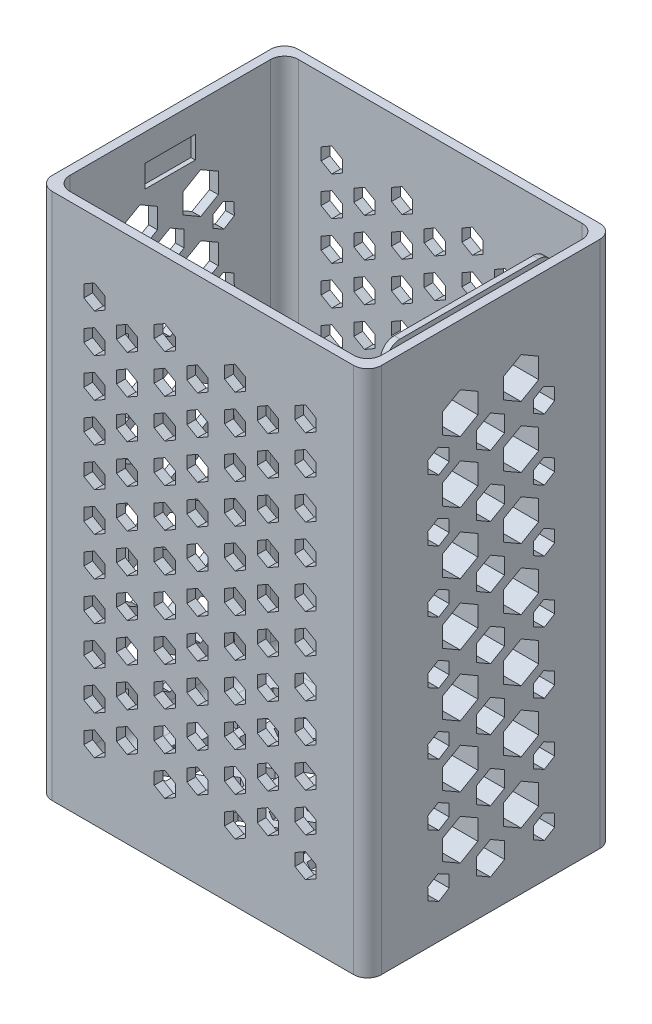
from build123d import *

# Parameters (mm, degrees)
SKETCH1_W                = 237.6932
SKETCH1_H                = 177.6984
SKETCH1_W_2              = 224.9932
SKETCH1_H_2              = 164.9984
BOSS_EXTRUDE1_DEPTH      = 374.65
SKETCH4_W                = 107.442
SKETCH4_H                = 374.65
BOSS_EXTRUDE2_DEPTH      = 9.017
SKETCH5_W                = 120.142
SKETCH5_H                = 374.65
BOSS_EXTRUDE3_DEPTH      = 4.191
SKETCH7_W                = 9.017
SKETCH7_H                = 107.442
CUT_EXTRUDE1_DEPTH       = 21.59
SKETCH10_W               = 4.191
SKETCH10_H               = 120.142
CUT_EXTRUDE2_DEPTH       = 5.588
FILLET1_R                = 10
FILLET2_R                = 10
FILLET3_R                = 10
FILLET4_R                = 10
FILLET5_R                = 10
FILLET6_R                = 10
FILLET7_R                = 10
SKETCH11_W               = 50.8
SKETCH11_H               = 15.24
BOSS_EXTRUDE4_DEPTH      = 19.9898
FILLET10_R               = 10
FILLET11_R               = 10
BOSS_EXTRUDE5_DEPTH      = 6.35
FILLET13_R               = 10
SKETCH13_W               = 36.3982
SKETCH13_H               = 16.129
CUT_EXTRUDE4_DEPTH       = 3.175
CUT_EXTRUDE5_DEPTH       = 6.35
CUT_EXTRUDE6_DEPTH       = 467.160768578
CUT_EXTRUDE6_DEPTH_BACK  = 467.160768578
CUT_EXTRUDE9_DEPTH       = 475.825252118
CUT_EXTRUDE9_DEPTH_BACK  = 475.825252118
CUT_EXTRUDE10_DEPTH      = 476.626906313
CUT_EXTRUDE10_DEPTH_BACK = 476.626906313
CUT_EXTRUDE11_DEPTH      = 476.626906313
CUT_EXTRUDE11_DEPTH_BACK = 476.626906313


with BuildPart() as part:
    # Sketch1 → Boss-Extrude1 (new body)
    with BuildSketch(Plane(origin=(0, 0, 0), x_dir=(1, 0, 0), z_dir=(0, 1, 0))):
        with Locations((112.4966, -82.4992)):
            Rectangle(SKETCH1_W, SKETCH1_H)
        with Locations((112.4966, -82.4992)):
            Rectangle(SKETCH1_W_2, SKETCH1_H_2, mode=Mode.SUBTRACT)
    extrude(amount=BOSS_EXTRUDE1_DEPTH)

    # Sketch4 → Boss-Extrude2 (add)
    with BuildSketch(Plane.ZY.offset(-224.9932)):
        with Locations((82.4484, 187.325)):
            Rectangle(SKETCH4_W, SKETCH4_H)
    extrude(amount=BOSS_EXTRUDE2_DEPTH)

    # Sketch5 → Boss-Extrude3 (add)
    with BuildSketch(Plane.ZY.offset(-215.9762)):
        with Locations((82.4484, 187.325)):
            Rectangle(SKETCH5_W, SKETCH5_H)
    extrude(amount=BOSS_EXTRUDE3_DEPTH)

    # Sketch7 → Cut-Extrude1 (cut)
    with BuildSketch(Plane(origin=(0, 374.65, 0), x_dir=(1, 0, 0), z_dir=(0, 1, 0))):
        with Locations((220.4847, -82.4484)):
            Rectangle(SKETCH7_W, SKETCH7_H)
    extrude(amount=-CUT_EXTRUDE1_DEPTH, mode=Mode.SUBTRACT)

    # Sketch10 → Cut-Extrude2 (cut)
    with BuildSketch(Plane(origin=(0, 374.65, 0), x_dir=(1, 0, 0), z_dir=(0, 1, 0))):
        with Locations((213.8807, -82.4484)):
            Rectangle(SKETCH10_W, SKETCH10_H)
    extrude(amount=-CUT_EXTRUDE2_DEPTH, mode=Mode.SUBTRACT)

    # Fillet1
    fillet1_edges = [part.edges().sort_by_distance(p)[0] for p in [
        (231.3432, 187.325, 171.3484),
    ]]
    fillet(fillet1_edges, radius=FILLET1_R)

    # Fillet2
    fillet2_edges = [part.edges().sort_by_distance(p)[0] for p in [
        (224.9932, 187.325, 164.9984),
    ]]
    fillet(fillet2_edges, radius=FILLET2_R)

    # Fillet3
    fillet3_edges = [part.edges().sort_by_distance(p)[0] for p in [
        (231.3432, 187.325, -6.35),
        (224.9932, 187.325, 0),
    ]]
    fillet(fillet3_edges, radius=FILLET3_R)

    # Fillet4
    fillet4_edges = [part.edges().sort_by_distance(p)[0] for p in [
        (-6.35, 187.325, 171.3484),
        (0, 187.325, 164.9984),
    ]]
    fillet(fillet4_edges, radius=FILLET4_R)

    # Fillet5
    fillet5_edges = [part.edges().sort_by_distance(p)[0] for p in [
        (0, 187.325, 0),
        (-6.35, 187.325, -6.35),
    ]]
    fillet(fillet5_edges, radius=FILLET5_R)

    # Fillet6
    fillet6_edges = [part.edges().sort_by_distance(p)[0] for p in [
        (220.4847, 353.06, 136.1694),
        (220.4847, 353.06, 28.7274),
    ]]
    fillet(fillet6_edges, radius=FILLET6_R)

    # Fillet7
    fillet7_edges = [part.edges().sort_by_distance(p)[0] for p in [
        (213.8807, 369.062, 22.3774),
        (213.8807, 369.062, 142.5194),
    ]]
    fillet(fillet7_edges, radius=FILLET7_R)

    # Sketch11 → Boss-Extrude4 (add)
    with BuildSketch(Plane.ZY.offset(-211.7852)):
        with Locations((82.4484, 7.62)):
            Rectangle(SKETCH11_W, SKETCH11_H)
    extrude(amount=BOSS_EXTRUDE4_DEPTH)

    # Fillet10
    fillet10_edges = [part.edges().sort_by_distance(p)[0] for p in [
        (191.7954, 7.62, 107.8484),
        (191.7954, 7.62, 57.0484),
    ]]
    fillet(fillet10_edges, radius=FILLET10_R)

    # Fillet11
    fillet11_edges = [part.edges().sort_by_distance(p)[0] for p in [
        (206.7903, 15.24, 107.8484),
        (194.724332188, 15.24, 104.919467812),
        (206.7903, 15.24, 57.0484),
        (194.724332188, 15.24, 59.977332188),
        (191.7954, 15.24, 82.4484),
    ]]
    fillet(fillet11_edges, radius=FILLET11_R)

    # Sketch12 → Boss-Extrude5 (add)
    with BuildSketch(Plane.XZ):
        with BuildLine():
            Line((231.3432, 161.3484), (231.3432, 3.65))
            ThreePointArc((231.3432, 3.65), (228.414267812, -3.421067812), (221.3432, -6.35))
            Line((221.3432, -6.35), (3.65, -6.35))
            ThreePointArc((3.65, -6.35), (-3.421067812, -3.421067812), (-6.35, 3.65))
            Line((-6.35, 3.65), (-6.35, 161.3484))
            ThreePointArc((-6.35, 161.3484), (-3.421067812, 168.419467812), (3.65, 171.3484))
            Line((3.65, 171.3484), (221.3432, 171.3484))
            ThreePointArc((221.3432, 171.3484), (228.414267812, 168.419467812), (231.3432, 161.3484))
        make_face()
    extrude(amount=BOSS_EXTRUDE5_DEPTH)

    # Fillet13
    fillet13_edges = [part.edges().sort_by_distance(p)[0] for p in [
        (224.9932, 0, 19.3637),
        (222.064267812, 0, 2.928932188),
        (112.4966, 0, 0),
        (2.928932188, 0, 2.928932188),
        (224.9932, 0, 145.5839),
        (222.064267812, 0, 162.069467812),
        (112.4966, 0, 164.9984),
        (2.928932188, 0, 162.069467812),
        (0, 0, 82.4992),
    ]]
    fillet(fillet13_edges, radius=FILLET13_R)

    # Sketch13 → Cut-Extrude4 (cut)
    with BuildSketch(Plane(origin=(0, 0, 0), x_dir=(0, 0, -1), z_dir=(1, 0, 0))):
        with Locations((-82.5551, 346.9767)):
            Rectangle(SKETCH13_W, SKETCH13_H)
    extrude(amount=-CUT_EXTRUDE4_DEPTH, mode=Mode.SUBTRACT)

    # Sketch15 → Cut-Extrude5 (cut)
    with BuildSketch(Plane.XZ.offset(6.35)):
        Polygon((177.8, 131.139877372), (184.15, 134.806051581), (184.15, 142.1384), (177.8, 145.80457421), (171.45, 142.1384), (171.45, 134.806051581), align=None)
        Polygon((196.85, 131.139877372), (203.2, 134.806051581), (203.2, 142.1384), (196.85, 145.80457421), (190.5, 142.1384), (190.5, 134.806051581), align=None)
        Polygon((158.75, 131.139877372), (165.1, 134.806051581), (165.1, 142.1384), (158.75, 145.80457421), (152.4, 142.1384), (152.4, 134.806051581), align=None)
        Polygon((139.7, 131.139877372), (146.05, 134.806051581), (146.05, 142.1384), (139.7, 145.80457421), (133.35, 142.1384), (133.35, 134.806051581), align=None)
        Polygon((120.65, 131.139877372), (127, 134.806051581), (127, 142.1384), (120.65, 145.80457421), (114.3, 142.1384), (114.3, 134.806051581), align=None)
        Polygon((101.6, 131.139877372), (107.95, 134.806051581), (107.95, 142.1384), (101.6, 145.80457421), (95.25, 142.1384), (95.25, 134.806051581), align=None)
        Polygon((82.55, 131.139877372), (88.9, 134.806051581), (88.9, 142.1384), (82.55, 145.80457421), (76.2, 142.1384), (76.2, 134.806051581), align=None)
        Polygon((63.5, 131.139877372), (69.85, 134.806051581), (69.85, 142.1384), (63.5, 145.80457421), (57.15, 142.1384), (57.15, 134.806051581), align=None)
        Polygon((44.45, 131.139877372), (50.8, 134.806051581), (50.8, 142.1384), (44.45, 145.80457421), (38.1, 142.1384), (38.1, 134.806051581), align=None)
        Polygon((25.4, 131.139877372), (31.75, 134.806051581), (31.75, 142.1384), (25.4, 145.80457421), (19.05, 142.1384), (19.05, 134.806051581), align=None)
        Polygon((32.471566581, 113.225602985), (38.821566581, 116.891777194), (38.821566581, 124.224125613), (32.471566581, 127.890299822), (26.121566581, 124.224125613), (26.121566581, 116.891777194), align=None)
        Polygon((51.521566581, 113.225602985), (57.871566581, 116.891777194), (57.871566581, 124.224125613), (51.521566581, 127.890299822), (45.171566581, 124.224125613), (45.171566581, 116.891777194), align=None)
        Polygon((70.571566581, 113.225602985), (76.921566581, 116.891777194), (76.921566581, 124.224125613), (70.571566581, 127.890299822), (64.221566581, 124.224125613), (64.221566581, 116.891777194), align=None)
        Polygon((89.621566581, 113.225602985), (95.971566581, 116.891777194), (95.971566581, 124.224125613), (89.621566581, 127.890299822), (83.271566581, 124.224125613), (83.271566581, 116.891777194), align=None)
        Polygon((108.671566581, 113.225602985), (115.021566581, 116.891777194), (115.021566581, 124.224125613), (108.671566581, 127.890299822), (102.321566581, 124.224125613), (102.321566581, 116.891777194), align=None)
        Polygon((127.721566581, 113.225602985), (134.071566581, 116.891777194), (134.071566581, 124.224125613), (127.721566581, 127.890299822), (121.371566581, 124.224125613), (121.371566581, 116.891777194), align=None)
        Polygon((146.771566581, 113.225602985), (153.121566581, 116.891777194), (153.121566581, 124.224125613), (146.771566581, 127.890299822), (140.421566581, 124.224125613), (140.421566581, 116.891777194), align=None)
        Polygon((165.821566581, 113.225602985), (172.171566581, 116.891777194), (172.171566581, 124.224125613), (165.821566581, 127.890299822), (159.471566581, 124.224125613), (159.471566581, 116.891777194), align=None)
        Polygon((184.871566581, 113.225602985), (191.221566581, 116.891777194), (191.221566581, 124.224125613), (184.871566581, 127.890299822), (178.521566581, 124.224125613), (178.521566581, 116.891777194), align=None)
        Polygon((25.4, 95.311328598), (31.75, 98.977502807), (31.75, 106.309851226), (25.4, 109.976025435), (19.05, 106.309851226), (19.05, 98.977502807), align=None)
        Polygon((44.45, 95.311328598), (50.8, 98.977502807), (50.8, 106.309851226), (44.45, 109.976025435), (38.1, 106.309851226), (38.1, 98.977502807), align=None)
        Polygon((63.5, 95.311328598), (69.85, 98.977502807), (69.85, 106.309851226), (63.5, 109.976025435), (57.15, 106.309851226), (57.15, 98.977502807), align=None)
        Polygon((82.55, 95.311328598), (88.9, 98.977502807), (88.9, 106.309851226), (82.55, 109.976025435), (76.2, 106.309851226), (76.2, 98.977502807), align=None)
        Polygon((101.6, 95.311328598), (107.95, 98.977502807), (107.95, 106.309851226), (101.6, 109.976025435), (95.25, 106.309851226), (95.25, 98.977502807), align=None)
        Polygon((120.65, 95.311328598), (127, 98.977502807), (127, 106.309851226), (120.65, 109.976025435), (114.3, 106.309851226), (114.3, 98.977502807), align=None)
        Polygon((139.7, 95.311328598), (146.05, 98.977502807), (146.05, 106.309851226), (139.7, 109.976025435), (133.35, 106.309851226), (133.35, 98.977502807), align=None)
        Polygon((158.75, 95.311328598), (165.1, 98.977502807), (165.1, 106.309851226), (158.75, 109.976025435), (152.4, 106.309851226), (152.4, 98.977502807), align=None)
        Polygon((177.8, 95.311328598), (184.15, 98.977502807), (184.15, 106.309851226), (177.8, 109.976025435), (171.45, 106.309851226), (171.45, 98.977502807), align=None)
        Polygon((184.871566581, 77.397054211), (191.221566581, 81.06322842), (191.221566581, 88.395576839), (184.871566581, 92.061751048), (178.521566581, 88.395576839), (178.521566581, 81.06322842), align=None)
        Polygon((165.821566581, 77.397054211), (172.171566581, 81.06322842), (172.171566581, 88.395576839), (165.821566581, 92.061751048), (159.471566581, 88.395576839), (159.471566581, 81.06322842), align=None)
        Polygon((146.771566581, 77.397054211), (153.121566581, 81.06322842), (153.121566581, 88.395576839), (146.771566581, 92.061751048), (140.421566581, 88.395576839), (140.421566581, 81.06322842), align=None)
        Polygon((127.721566581, 77.397054211), (134.071566581, 81.06322842), (134.071566581, 88.395576839), (127.721566581, 92.061751048), (121.371566581, 88.395576839), (121.371566581, 81.06322842), align=None)
        Polygon((108.671566581, 77.397054211), (115.021566581, 81.06322842), (115.021566581, 88.395576839), (108.671566581, 92.061751048), (102.321566581, 88.395576839), (102.321566581, 81.06322842), align=None)
        Polygon((89.621566581, 77.397054211), (95.971566581, 81.06322842), (95.971566581, 88.395576839), (89.621566581, 92.061751048), (83.271566581, 88.395576839), (83.271566581, 81.06322842), align=None)
        Polygon((70.571566581, 77.397054211), (76.921566581, 81.06322842), (76.921566581, 88.395576839), (70.571566581, 92.061751048), (64.221566581, 88.395576839), (64.221566581, 81.06322842), align=None)
        Polygon((51.521566581, 77.397054211), (57.871566581, 81.06322842), (57.871566581, 88.395576839), (51.521566581, 92.061751048), (45.171566581, 88.395576839), (45.171566581, 81.06322842), align=None)
        Polygon((32.471566581, 77.397054211), (38.821566581, 81.06322842), (38.821566581, 88.395576839), (32.471566581, 92.061751048), (26.121566581, 88.395576839), (26.121566581, 81.06322842), align=None)
        Polygon((25.4, 59.482779824), (31.75, 63.148954033), (31.75, 70.481302452), (25.4, 74.147476661), (19.05, 70.481302452), (19.05, 63.148954033), align=None)
        Polygon((44.45, 59.482779824), (50.8, 63.148954033), (50.8, 70.481302452), (44.45, 74.147476661), (38.1, 70.481302452), (38.1, 63.148954033), align=None)
        Polygon((63.5, 59.482779824), (69.85, 63.148954033), (69.85, 70.481302452), (63.5, 74.147476661), (57.15, 70.481302452), (57.15, 63.148954033), align=None)
        Polygon((82.55, 59.482779824), (88.9, 63.148954033), (88.9, 70.481302452), (82.55, 74.147476661), (76.2, 70.481302452), (76.2, 63.148954033), align=None)
        Polygon((101.6, 59.482779824), (107.95, 63.148954033), (107.95, 70.481302452), (101.6, 74.147476661), (95.25, 70.481302452), (95.25, 63.148954033), align=None)
        Polygon((120.65, 59.482779824), (127, 63.148954033), (127, 70.481302452), (120.65, 74.147476661), (114.3, 70.481302452), (114.3, 63.148954033), align=None)
        Polygon((139.7, 59.482779824), (146.05, 63.148954033), (146.05, 70.481302452), (139.7, 74.147476661), (133.35, 70.481302452), (133.35, 63.148954033), align=None)
        Polygon((158.75, 59.482779824), (165.1, 63.148954033), (165.1, 70.481302452), (158.75, 74.147476661), (152.4, 70.481302452), (152.4, 63.148954033), align=None)
        Polygon((177.8, 59.482779824), (184.15, 63.148954033), (184.15, 70.481302452), (177.8, 74.147476661), (171.45, 70.481302452), (171.45, 63.148954033), align=None)
        Polygon((184.871566581, 41.568505436), (191.221566581, 45.234679646), (191.221566581, 52.567028064), (184.871566581, 56.233202274), (178.521566581, 52.567028064), (178.521566581, 45.234679646), align=None)
        Polygon((165.821566581, 41.568505436), (172.171566581, 45.234679646), (172.171566581, 52.567028064), (165.821566581, 56.233202274), (159.471566581, 52.567028064), (159.471566581, 45.234679646), align=None)
        Polygon((146.771566581, 41.568505436), (153.121566581, 45.234679646), (153.121566581, 52.567028064), (146.771566581, 56.233202274), (140.421566581, 52.567028064), (140.421566581, 45.234679646), align=None)
        Polygon((127.721566581, 41.568505436), (134.071566581, 45.234679646), (134.071566581, 52.567028064), (127.721566581, 56.233202274), (121.371566581, 52.567028064), (121.371566581, 45.234679646), align=None)
        Polygon((108.671566581, 41.568505436), (115.021566581, 45.234679646), (115.021566581, 52.567028064), (108.671566581, 56.233202274), (102.321566581, 52.567028064), (102.321566581, 45.234679646), align=None)
        Polygon((89.621566581, 41.568505436), (95.971566581, 45.234679646), (95.971566581, 52.567028064), (89.621566581, 56.233202274), (83.271566581, 52.567028064), (83.271566581, 45.234679646), align=None)
        Polygon((70.571566581, 41.568505436), (76.921566581, 45.234679646), (76.921566581, 52.567028064), (70.571566581, 56.233202274), (64.221566581, 52.567028064), (64.221566581, 45.234679646), align=None)
        Polygon((51.521566581, 41.568505436), (57.871566581, 45.234679646), (57.871566581, 52.567028064), (51.521566581, 56.233202274), (45.171566581, 52.567028064), (45.171566581, 45.234679646), align=None)
        Polygon((32.471566581, 41.568505436), (38.821566581, 45.234679646), (38.821566581, 52.567028064), (32.471566581, 56.233202274), (26.121566581, 52.567028064), (26.121566581, 45.234679646), align=None)
        Polygon((25.4, 23.654231049), (31.75, 27.320405259), (31.75, 34.652753677), (25.4, 38.318927887), (19.05, 34.652753677), (19.05, 27.320405259), align=None)
        Polygon((44.45, 23.654231049), (50.8, 27.320405259), (50.8, 34.652753677), (44.45, 38.318927887), (38.1, 34.652753677), (38.1, 27.320405259), align=None)
        Polygon((63.5, 23.654231049), (69.85, 27.320405259), (69.85, 34.652753677), (63.5, 38.318927887), (57.15, 34.652753677), (57.15, 27.320405259), align=None)
        Polygon((82.55, 23.654231049), (88.9, 27.320405259), (88.9, 34.652753677), (82.55, 38.318927887), (76.2, 34.652753677), (76.2, 27.320405259), align=None)
        Polygon((101.6, 23.654231049), (107.95, 27.320405259), (107.95, 34.652753677), (101.6, 38.318927887), (95.25, 34.652753677), (95.25, 27.320405259), align=None)
        Polygon((120.65, 23.654231049), (127, 27.320405259), (127, 34.652753677), (120.65, 38.318927887), (114.3, 34.652753677), (114.3, 27.320405259), align=None)
        Polygon((139.7, 23.654231049), (146.05, 27.320405259), (146.05, 34.652753677), (139.7, 38.318927887), (133.35, 34.652753677), (133.35, 27.320405259), align=None)
        Polygon((158.75, 23.654231049), (165.1, 27.320405259), (165.1, 34.652753677), (158.75, 38.318927887), (152.4, 34.652753677), (152.4, 27.320405259), align=None)
        Polygon((177.8, 23.654231049), (184.15, 27.320405259), (184.15, 34.652753677), (177.8, 38.318927887), (171.45, 34.652753677), (171.45, 27.320405259), align=None)
        Polygon((196.85, 23.654231049), (203.2, 27.320405259), (203.2, 34.652753677), (196.85, 38.318927887), (190.5, 34.652753677), (190.5, 27.320405259), align=None)
    extrude(amount=-CUT_EXTRUDE5_DEPTH, mode=Mode.SUBTRACT)

    # Sketch18 → Cut-Extrude6 (cut, two sides: drawn at the far end of the back side and taken through both)
    with BuildSketch(Plane.ZY.offset(-211.7852).offset(-CUT_EXTRUDE6_DEPTH_BACK)):
        Polygon((73.1774, 323.629651581), (60.4774, 330.962), (47.7774, 323.629651581), (47.7774, 308.964954744), (60.4774, 301.632606325), (73.1774, 308.964954744), align=None)
        Polygon((117.1194, 323.629651581), (104.4194, 330.962), (91.7194, 323.629651581), (91.7194, 308.964954744), (104.4194, 301.632606325), (117.1194, 308.964954744), align=None)
        Polygon((73.1774, 279.179651581), (60.4774, 286.512), (47.7774, 279.179651581), (47.7774, 264.514954744), (60.4774, 257.182606325), (73.1774, 264.514954744), align=None)
        Polygon((73.1774, 234.729651581), (60.4774, 242.062), (47.7774, 234.729651581), (47.7774, 220.064954744), (60.4774, 212.732606325), (73.1774, 220.064954744), align=None)
        Polygon((73.1774, 190.279651581), (60.4774, 197.612), (47.7774, 190.279651581), (47.7774, 175.614954744), (60.4774, 168.282606325), (73.1774, 175.614954744), align=None)
        Polygon((73.1774, 145.829651581), (60.4774, 153.162), (47.7774, 145.829651581), (47.7774, 131.164954744), (60.4774, 123.832606325), (73.1774, 131.164954744), align=None)
        Polygon((73.1774, 101.379651581), (60.4774, 108.712), (47.7774, 101.379651581), (47.7774, 86.714954744), (60.4774, 79.382606325), (73.1774, 86.714954744), align=None)
        Polygon((73.1774, 56.929651581), (60.4774, 64.262), (47.7774, 56.929651581), (47.7774, 42.264954744), (60.4774, 34.932606325), (73.1774, 42.264954744), align=None)
        Polygon((117.1194, 279.179651581), (104.4194, 286.512), (91.7194, 279.179651581), (91.7194, 264.514954744), (104.4194, 257.182606325), (117.1194, 264.514954744), align=None)
        Polygon((117.1194, 234.729651581), (104.4194, 242.062), (91.7194, 234.729651581), (91.7194, 220.064954744), (104.4194, 212.732606325), (117.1194, 220.064954744), align=None)
        Polygon((117.1194, 190.279651581), (104.4194, 197.612), (91.7194, 190.279651581), (91.7194, 175.614954744), (104.4194, 168.282606325), (117.1194, 175.614954744), align=None)
        Polygon((117.1194, 145.829651581), (104.4194, 153.162), (91.7194, 145.829651581), (91.7194, 131.164954744), (104.4194, 123.832606325), (117.1194, 131.164954744), align=None)
        Polygon((117.1194, 101.379651581), (104.4194, 108.712), (91.7194, 101.379651581), (91.7194, 86.714954744), (104.4194, 79.382606325), (117.1194, 86.714954744), align=None)
        Polygon((117.1194, 56.929651581), (104.4194, 64.262), (91.7194, 56.929651581), (91.7194, 42.264954744), (104.4194, 34.932606325), (117.1194, 42.264954744), align=None)
    extrude(amount=CUT_EXTRUDE6_DEPTH + CUT_EXTRUDE6_DEPTH_BACK, mode=Mode.SUBTRACT)

    # Sketch23 → Cut-Extrude9 (cut, two sides: drawn at the far end of the back side and taken through both)
    with BuildSketch(Plane.XY.offset(171.3484).offset(-CUT_EXTRUDE9_DEPTH_BACK)):
        Polygon((34.13, 315.051181898), (41.75, 319.450590949), (41.75, 328.249409051), (34.13, 332.648818102), (26.51, 328.249409051), (26.51, 319.450590949), align=None)
        Polygon((41.75, 300.309409051), (34.13, 304.708818102), (26.51, 300.309409051), (26.51, 291.510590949), (34.13, 287.111181898), (41.75, 291.510590949), align=None)
        Polygon((41.75, 272.369409051), (34.13, 276.768818102), (26.51, 272.369409051), (26.51, 263.570590949), (34.13, 259.171181898), (41.75, 263.570590949), align=None)
        Polygon((41.75, 244.429409051), (34.13, 248.828818102), (26.51, 244.429409051), (26.51, 235.630590949), (34.13, 231.231181898), (41.75, 235.630590949), align=None)
        Polygon((41.75, 216.489409051), (34.13, 220.888818102), (26.51, 216.489409051), (26.51, 207.690590949), (34.13, 203.291181898), (41.75, 207.690590949), align=None)
        Polygon((41.75, 188.549409051), (34.13, 192.948818102), (26.51, 188.549409051), (26.51, 179.750590949), (34.13, 175.351181898), (41.75, 179.750590949), align=None)
        Polygon((41.75, 160.609409051), (34.13, 165.008818102), (26.51, 160.609409051), (26.51, 151.810590949), (34.13, 147.411181898), (41.75, 151.810590949), align=None)
        Polygon((41.75, 132.669409051), (34.13, 137.068818102), (26.51, 132.669409051), (26.51, 123.870590949), (34.13, 119.471181898), (41.75, 123.870590949), align=None)
        Polygon((41.75, 104.729409051), (34.13, 109.128818102), (26.51, 104.729409051), (26.51, 95.930590949), (34.13, 91.531181898), (41.75, 95.930590949), align=None)
        Polygon((41.75, 76.789409051), (34.13, 81.188818102), (26.51, 76.789409051), (26.51, 67.990590949), (34.13, 63.591181898), (41.75, 67.990590949), align=None)
        Polygon((41.75, 48.849409051), (34.13, 53.248818102), (26.51, 48.849409051), (26.51, 40.050590949), (34.13, 35.651181898), (41.75, 40.050590949), align=None)
        Polygon((65.376240404, 314.187335919), (57.756240404, 318.58674497), (50.136240404, 314.187335919), (50.136240404, 305.388517816), (57.756240404, 300.989108765), (65.376240404, 305.388517816), align=None)
        Polygon((65.376240404, 286.247335919), (57.756240404, 290.64674497), (50.136240404, 286.247335919), (50.136240404, 277.448517816), (57.756240404, 273.049108765), (65.376240404, 277.448517816), align=None)
        Polygon((65.376240404, 258.307335919), (57.756240404, 262.70674497), (50.136240404, 258.307335919), (50.136240404, 249.508517816), (57.756240404, 245.109108765), (65.376240404, 249.508517816), align=None)
        Polygon((65.376240404, 230.367335919), (57.756240404, 234.76674497), (50.136240404, 230.367335919), (50.136240404, 221.568517816), (57.756240404, 217.169108765), (65.376240404, 221.568517816), align=None)
        Polygon((65.376240404, 202.427335919), (57.756240404, 206.82674497), (50.136240404, 202.427335919), (50.136240404, 193.628517816), (57.756240404, 189.229108765), (65.376240404, 193.628517816), align=None)
        Polygon((65.376240404, 174.487335919), (57.756240404, 178.88674497), (50.136240404, 174.487335919), (50.136240404, 165.688517816), (57.756240404, 161.289108765), (65.376240404, 165.688517816), align=None)
        Polygon((65.376240404, 146.547335919), (57.756240404, 150.94674497), (50.136240404, 146.547335919), (50.136240404, 137.748517816), (57.756240404, 133.349108765), (65.376240404, 137.748517816), align=None)
        Polygon((65.376240404, 118.607335919), (57.756240404, 123.00674497), (50.136240404, 118.607335919), (50.136240404, 109.808517816), (57.756240404, 105.409108765), (65.376240404, 109.808517816), align=None)
        Polygon((65.376240404, 90.667335919), (57.756240404, 95.06674497), (50.136240404, 90.667335919), (50.136240404, 81.868517816), (57.756240404, 77.469108765), (65.376240404, 81.868517816), align=None)
        Polygon((65.376240404, 62.727335919), (57.756240404, 67.12674497), (50.136240404, 62.727335919), (50.136240404, 53.928517816), (57.756240404, 49.529108765), (65.376240404, 53.928517816), align=None)
        Polygon((84.93, 315.051181898), (92.55, 319.450590949), (92.55, 328.249409051), (84.93, 332.648818102), (77.31, 328.249409051), (77.31, 319.450590949), align=None)
        Polygon((92.55, 300.309409051), (84.93, 304.708818102), (77.31, 300.309409051), (77.31, 291.510590949), (84.93, 287.111181898), (92.55, 291.510590949), align=None)
        Polygon((92.55, 272.369409051), (84.93, 276.768818102), (77.31, 272.369409051), (77.31, 263.570590949), (84.93, 259.171181898), (92.55, 263.570590949), align=None)
        Polygon((92.55, 244.429409051), (84.93, 248.828818102), (77.31, 244.429409051), (77.31, 235.630590949), (84.93, 231.231181898), (92.55, 235.630590949), align=None)
        Polygon((92.55, 216.489409051), (84.93, 220.888818102), (77.31, 216.489409051), (77.31, 207.690590949), (84.93, 203.291181898), (92.55, 207.690590949), align=None)
        Polygon((92.55, 188.549409051), (84.93, 192.948818102), (77.31, 188.549409051), (77.31, 179.750590949), (84.93, 175.351181898), (92.55, 179.750590949), align=None)
        Polygon((92.55, 160.609409051), (84.93, 165.008818102), (77.31, 160.609409051), (77.31, 151.810590949), (84.93, 147.411181898), (92.55, 151.810590949), align=None)
        Polygon((92.55, 132.669409051), (84.93, 137.068818102), (77.31, 132.669409051), (77.31, 123.870590949), (84.93, 119.471181898), (92.55, 123.870590949), align=None)
        Polygon((92.55, 104.729409051), (84.93, 109.128818102), (77.31, 104.729409051), (77.31, 95.930590949), (84.93, 91.531181898), (92.55, 95.930590949), align=None)
        Polygon((92.55, 76.789409051), (84.93, 81.188818102), (77.31, 76.789409051), (77.31, 67.990590949), (84.93, 63.591181898), (92.55, 67.990590949), align=None)
        Polygon((92.55, 48.849409051), (84.93, 53.248818102), (77.31, 48.849409051), (77.31, 40.050590949), (84.93, 35.651181898), (92.55, 40.050590949), align=None)
        Polygon((116.176240404, 314.187335919), (108.556240404, 318.58674497), (100.936240404, 314.187335919), (100.936240404, 305.388517816), (108.556240404, 300.989108765), (116.176240404, 305.388517816), align=None)
        Polygon((116.176240404, 286.247335919), (108.556240404, 290.64674497), (100.936240404, 286.247335919), (100.936240404, 277.448517816), (108.556240404, 273.049108765), (116.176240404, 277.448517816), align=None)
        Polygon((116.176240404, 258.307335919), (108.556240404, 262.70674497), (100.936240404, 258.307335919), (100.936240404, 249.508517816), (108.556240404, 245.109108765), (116.176240404, 249.508517816), align=None)
        Polygon((116.176240404, 230.367335919), (108.556240404, 234.76674497), (100.936240404, 230.367335919), (100.936240404, 221.568517816), (108.556240404, 217.169108765), (116.176240404, 221.568517816), align=None)
        Polygon((116.176240404, 202.427335919), (108.556240404, 206.82674497), (100.936240404, 202.427335919), (100.936240404, 193.628517816), (108.556240404, 189.229108765), (116.176240404, 193.628517816), align=None)
        Polygon((116.176240404, 174.487335919), (108.556240404, 178.88674497), (100.936240404, 174.487335919), (100.936240404, 165.688517816), (108.556240404, 161.289108765), (116.176240404, 165.688517816), align=None)
        Polygon((116.176240404, 146.547335919), (108.556240404, 150.94674497), (100.936240404, 146.547335919), (100.936240404, 137.748517816), (108.556240404, 133.349108765), (116.176240404, 137.748517816), align=None)
        Polygon((116.176240404, 118.607335919), (108.556240404, 123.00674497), (100.936240404, 118.607335919), (100.936240404, 109.808517816), (108.556240404, 105.409108765), (116.176240404, 109.808517816), align=None)
        Polygon((116.176240404, 90.667335919), (108.556240404, 95.06674497), (100.936240404, 90.667335919), (100.936240404, 81.868517816), (108.556240404, 77.469108765), (116.176240404, 81.868517816), align=None)
        Polygon((116.176240404, 62.727335919), (108.556240404, 67.12674497), (100.936240404, 62.727335919), (100.936240404, 53.928517816), (108.556240404, 49.529108765), (116.176240404, 53.928517816), align=None)
        Polygon((135.73, 315.051181898), (143.35, 319.450590949), (143.35, 328.249409051), (135.73, 332.648818102), (128.11, 328.249409051), (128.11, 319.450590949), align=None)
        Polygon((143.35, 300.309409051), (135.73, 304.708818102), (128.11, 300.309409051), (128.11, 291.510590949), (135.73, 287.111181898), (143.35, 291.510590949), align=None)
        Polygon((143.35, 272.369409051), (135.73, 276.768818102), (128.11, 272.369409051), (128.11, 263.570590949), (135.73, 259.171181898), (143.35, 263.570590949), align=None)
        Polygon((143.35, 244.429409051), (135.73, 248.828818102), (128.11, 244.429409051), (128.11, 235.630590949), (135.73, 231.231181898), (143.35, 235.630590949), align=None)
        Polygon((143.35, 216.489409051), (135.73, 220.888818102), (128.11, 216.489409051), (128.11, 207.690590949), (135.73, 203.291181898), (143.35, 207.690590949), align=None)
        Polygon((143.35, 188.549409051), (135.73, 192.948818102), (128.11, 188.549409051), (128.11, 179.750590949), (135.73, 175.351181898), (143.35, 179.750590949), align=None)
        Polygon((143.35, 160.609409051), (135.73, 165.008818102), (128.11, 160.609409051), (128.11, 151.810590949), (135.73, 147.411181898), (143.35, 151.810590949), align=None)
        Polygon((143.35, 132.669409051), (135.73, 137.068818102), (128.11, 132.669409051), (128.11, 123.870590949), (135.73, 119.471181898), (143.35, 123.870590949), align=None)
        Polygon((143.35, 104.729409051), (135.73, 109.128818102), (128.11, 104.729409051), (128.11, 95.930590949), (135.73, 91.531181898), (143.35, 95.930590949), align=None)
        Polygon((143.35, 76.789409051), (135.73, 81.188818102), (128.11, 76.789409051), (128.11, 67.990590949), (135.73, 63.591181898), (143.35, 67.990590949), align=None)
        Polygon((143.35, 48.849409051), (135.73, 53.248818102), (128.11, 48.849409051), (128.11, 40.050590949), (135.73, 35.651181898), (143.35, 40.050590949), align=None)
        Polygon((166.976240404, 314.187335919), (159.356240404, 318.58674497), (151.736240404, 314.187335919), (151.736240404, 305.388517816), (159.356240404, 300.989108765), (166.976240404, 305.388517816), align=None)
        Polygon((166.976240404, 286.247335919), (159.356240404, 290.64674497), (151.736240404, 286.247335919), (151.736240404, 277.448517816), (159.356240404, 273.049108765), (166.976240404, 277.448517816), align=None)
        Polygon((166.976240404, 258.307335919), (159.356240404, 262.70674497), (151.736240404, 258.307335919), (151.736240404, 249.508517816), (159.356240404, 245.109108765), (166.976240404, 249.508517816), align=None)
        Polygon((166.976240404, 230.367335919), (159.356240404, 234.76674497), (151.736240404, 230.367335919), (151.736240404, 221.568517816), (159.356240404, 217.169108765), (166.976240404, 221.568517816), align=None)
        Polygon((166.976240404, 202.427335919), (159.356240404, 206.82674497), (151.736240404, 202.427335919), (151.736240404, 193.628517816), (159.356240404, 189.229108765), (166.976240404, 193.628517816), align=None)
        Polygon((166.976240404, 174.487335919), (159.356240404, 178.88674497), (151.736240404, 174.487335919), (151.736240404, 165.688517816), (159.356240404, 161.289108765), (166.976240404, 165.688517816), align=None)
        Polygon((166.976240404, 146.547335919), (159.356240404, 150.94674497), (151.736240404, 146.547335919), (151.736240404, 137.748517816), (159.356240404, 133.349108765), (166.976240404, 137.748517816), align=None)
        Polygon((166.976240404, 118.607335919), (159.356240404, 123.00674497), (151.736240404, 118.607335919), (151.736240404, 109.808517816), (159.356240404, 105.409108765), (166.976240404, 109.808517816), align=None)
        Polygon((166.976240404, 90.667335919), (159.356240404, 95.06674497), (151.736240404, 90.667335919), (151.736240404, 81.868517816), (159.356240404, 77.469108765), (166.976240404, 81.868517816), align=None)
        Polygon((166.976240404, 62.727335919), (159.356240404, 67.12674497), (151.736240404, 62.727335919), (151.736240404, 53.928517816), (159.356240404, 49.529108765), (166.976240404, 53.928517816), align=None)
        Polygon((186.53, 315.051181898), (194.15, 319.450590949), (194.15, 328.249409051), (186.53, 332.648818102), (178.91, 328.249409051), (178.91, 319.450590949), align=None)
        Polygon((194.15, 300.309409051), (186.53, 304.708818102), (178.91, 300.309409051), (178.91, 291.510590949), (186.53, 287.111181898), (194.15, 291.510590949), align=None)
        Polygon((194.15, 272.369409051), (186.53, 276.768818102), (178.91, 272.369409051), (178.91, 263.570590949), (186.53, 259.171181898), (194.15, 263.570590949), align=None)
        Polygon((194.15, 244.429409051), (186.53, 248.828818102), (178.91, 244.429409051), (178.91, 235.630590949), (186.53, 231.231181898), (194.15, 235.630590949), align=None)
        Polygon((194.15, 216.489409051), (186.53, 220.888818102), (178.91, 216.489409051), (178.91, 207.690590949), (186.53, 203.291181898), (194.15, 207.690590949), align=None)
        Polygon((194.15, 188.549409051), (186.53, 192.948818102), (178.91, 188.549409051), (178.91, 179.750590949), (186.53, 175.351181898), (194.15, 179.750590949), align=None)
        Polygon((194.15, 160.609409051), (186.53, 165.008818102), (178.91, 160.609409051), (178.91, 151.810590949), (186.53, 147.411181898), (194.15, 151.810590949), align=None)
        Polygon((194.15, 132.669409051), (186.53, 137.068818102), (178.91, 132.669409051), (178.91, 123.870590949), (186.53, 119.471181898), (194.15, 123.870590949), align=None)
        Polygon((194.15, 104.729409051), (186.53, 109.128818102), (178.91, 104.729409051), (178.91, 95.930590949), (186.53, 91.531181898), (194.15, 95.930590949), align=None)
        Polygon((194.15, 76.789409051), (186.53, 81.188818102), (178.91, 76.789409051), (178.91, 67.990590949), (186.53, 63.591181898), (194.15, 67.990590949), align=None)
        Polygon((194.15, 48.849409051), (186.53, 53.248818102), (178.91, 48.849409051), (178.91, 40.050590949), (186.53, 35.651181898), (194.15, 40.050590949), align=None)
    extrude(amount=CUT_EXTRUDE9_DEPTH + CUT_EXTRUDE9_DEPTH_BACK, mode=Mode.SUBTRACT)

    # Sketch24 → Cut-Extrude10 (cut, two sides: drawn at the far end of the back side and taken through both)
    with BuildSketch(Plane(origin=(231.3432, 0, 0), x_dir=(0, 0, -1), z_dir=(1, 0, 0)).offset(-CUT_EXTRUDE10_DEPTH_BACK)):
        Polygon((-72.4484, 255.224178876), (-82.6084, 261.090057611), (-92.7684, 255.224178876), (-92.7684, 243.492421406), (-82.6084, 237.626542671), (-72.4484, 243.492421406), align=None)
        Polygon((-82.6084, 282.076542671), (-72.4484, 287.942421406), (-72.4484, 299.674178876), (-82.6084, 305.540057611), (-92.7684, 299.674178876), (-92.7684, 287.942421406), align=None)
        Polygon((-72.4484, 210.774178876), (-82.6084, 216.640057611), (-92.7684, 210.774178876), (-92.7684, 199.042421406), (-82.6084, 193.176542671), (-72.4484, 199.042421406), align=None)
        Polygon((-72.4484, 166.324178876), (-82.6084, 172.190057611), (-92.7684, 166.324178876), (-92.7684, 154.592421406), (-82.6084, 148.726542671), (-72.4484, 154.592421406), align=None)
        Polygon((-72.4484, 121.874178876), (-82.6084, 127.740057611), (-92.7684, 121.874178876), (-92.7684, 110.142421406), (-82.6084, 104.276542671), (-72.4484, 110.142421406), align=None)
        Polygon((-72.4484, 77.424178876), (-82.6084, 83.290057611), (-92.7684, 77.424178876), (-92.7684, 65.692421406), (-82.6084, 59.826542671), (-72.4484, 65.692421406), align=None)
        Polygon((-72.4484, 32.974178876), (-82.6084, 38.840057611), (-92.7684, 32.974178876), (-92.7684, 21.242421406), (-82.6084, 15.376542671), (-72.4484, 21.242421406), align=None)
    extrude(amount=CUT_EXTRUDE10_DEPTH + CUT_EXTRUDE10_DEPTH_BACK, mode=Mode.SUBTRACT)

    # Sketch25 → Cut-Extrude11 (cut, two sides: drawn at the far end of the back side and taken through both)
    with BuildSketch(Plane(origin=(231.3432, 0, 0), x_dir=(0, 0, -1), z_dir=(1, 0, 0)).offset(-CUT_EXTRUDE11_DEPTH_BACK)):
        Polygon((-120.405794491, 303.038101784), (-127.891811311, 298.414385512), (-127.630563971, 289.619446637), (-119.883299809, 285.448224032), (-112.397282989, 290.071940304), (-112.658530329, 298.86687918), align=None)
        Polygon((-36.458530329, 298.86687918), (-44.205794491, 303.038101784), (-51.691811311, 298.414385512), (-51.430563971, 289.619446637), (-43.683299809, 285.448224032), (-36.197282989, 290.071940304), align=None)
        Polygon((-120.405794491, 258.588101784), (-127.891811311, 253.964385512), (-127.630563971, 245.169446637), (-119.883299809, 240.998224032), (-112.397282989, 245.621940304), (-112.658530329, 254.41687918), align=None)
        Polygon((-120.405794491, 214.138101784), (-127.891811311, 209.514385512), (-127.630563971, 200.719446637), (-119.883299809, 196.548224032), (-112.397282989, 201.171940304), (-112.658530329, 209.96687918), align=None)
        Polygon((-120.405794491, 169.688101784), (-127.891811311, 165.064385512), (-127.630563971, 156.269446637), (-119.883299809, 152.098224033), (-112.397282989, 156.721940304), (-112.658530329, 165.51687918), align=None)
        Polygon((-120.405794491, 125.238101784), (-127.891811311, 120.614385512), (-127.630563971, 111.819446637), (-119.883299809, 107.648224033), (-112.397282989, 112.271940304), (-112.658530329, 121.06687918), align=None)
        Polygon((-120.405794491, 80.788101784), (-127.891811311, 76.164385512), (-127.630563971, 67.369446637), (-119.883299809, 63.198224033), (-112.397282989, 67.821940304), (-112.658530329, 76.61687918), align=None)
        Polygon((-120.405794491, 36.338101784), (-127.891811311, 31.714385512), (-127.630563971, 22.919446637), (-119.883299809, 18.748224033), (-112.397282989, 23.371940304), (-112.658530329, 32.16687918), align=None)
        Polygon((-44.205794491, 258.588101784), (-51.691811311, 253.964385512), (-51.430563971, 245.169446637), (-43.683299809, 240.998224032), (-36.197282989, 245.621940304), (-36.458530329, 254.41687918), align=None)
        Polygon((-44.205794491, 214.138101784), (-51.691811311, 209.514385512), (-51.430563971, 200.719446637), (-43.683299809, 196.548224032), (-36.197282989, 201.171940304), (-36.458530329, 209.96687918), align=None)
        Polygon((-44.205794491, 169.688101784), (-51.691811311, 165.064385512), (-51.430563971, 156.269446637), (-43.683299809, 152.098224033), (-36.197282989, 156.721940304), (-36.458530329, 165.51687918), align=None)
        Polygon((-44.205794491, 125.238101784), (-51.691811311, 120.614385512), (-51.430563971, 111.819446637), (-43.683299809, 107.648224033), (-36.197282989, 112.271940304), (-36.458530329, 121.06687918), align=None)
        Polygon((-44.205794491, 80.788101784), (-51.691811311, 76.164385512), (-51.430563971, 67.369446637), (-43.683299809, 63.198224033), (-36.197282989, 67.821940304), (-36.458530329, 76.61687918), align=None)
        Polygon((-44.205794491, 36.338101784), (-51.691811311, 31.714385512), (-51.430563971, 22.919446637), (-43.683299809, 18.748224033), (-36.197282989, 23.371940304), (-36.458530329, 32.16687918), align=None)
    extrude(amount=CUT_EXTRUDE11_DEPTH + CUT_EXTRUDE11_DEPTH_BACK, mode=Mode.SUBTRACT)


solid = part.part
